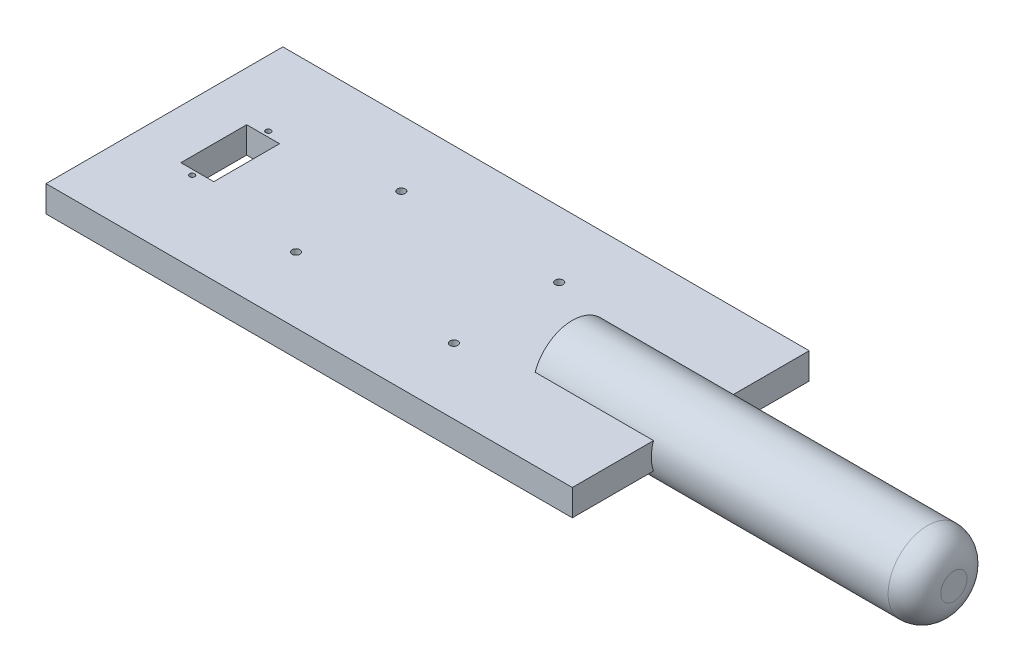
from build123d import *

# Parameters (mm, degrees)
CROQUIS1_W            = 200
CROQUIS1_H            = 90
CROQUIS1_R            = 1
CROQUIS1_W_2          = 12.5
CROQUIS1_H_2          = 25
BASE_DEPTH            = 10
CROQUIS2_R            = 1.5
CORTAR_EXTRUIR1_DEPTH = 111.113577728
MANGO_DEPTH           = 100
MANGO_DEPTH_BACK      = 45
CROQUIS3_R            = 15
REDONDEO_MANGO_R      = 10


with BuildPart() as part:
    # Croquis1 → Base (new body)
    with BuildSketch(Plane(origin=(0, 0, 0), x_dir=(1, 0, 0), z_dir=(0, 1, 0))):
        Rectangle(CROQUIS1_W, CROQUIS1_H)
        with Locations((-75, 14.5)):
            Circle(CROQUIS1_R, mode=Mode.SUBTRACT)
        with Locations((-75, -14.5)):
            Circle(CROQUIS1_R, mode=Mode.SUBTRACT)
        with Locations((-75, 0)):
            Rectangle(CROQUIS1_W_2, CROQUIS1_H_2, mode=Mode.SUBTRACT)
    extrude(amount=BASE_DEPTH)

    # Croquis2 → Cortar-Extruir1 (cut, through all)
    with BuildSketch(Plane(origin=(0, 10, 0), x_dir=(1, 0, 0), z_dir=(0, 1, 0))):
        with Locations((-30, 20)):
            Circle(CROQUIS2_R)
        with Locations((30, 20)):
            Circle(CROQUIS2_R)
        with Locations((30, -20)):
            Circle(CROQUIS2_R)
        with Locations((-30, -20)):
            Circle(CROQUIS2_R)
    extrude(amount=-CORTAR_EXTRUIR1_DEPTH, mode=Mode.SUBTRACT)

    # Croquis3 → Mango (add, two sides: drawn at the far end of the back side and taken through both)
    with BuildSketch(Plane(origin=(100, 0, 0), x_dir=(0, 0, -1), z_dir=(1, 0, 0)).offset(-MANGO_DEPTH_BACK)):
        with Locations((0, 5)):
            Circle(CROQUIS3_R)
    extrude(amount=MANGO_DEPTH + MANGO_DEPTH_BACK)

    # Redondeo Mango
    redondeo_mango_edges = [part.edges().sort_by_distance(p)[0] for p in [
        (200, 5, 15),
    ]]
    fillet(redondeo_mango_edges, radius=REDONDEO_MANGO_R)


solid = part.part
